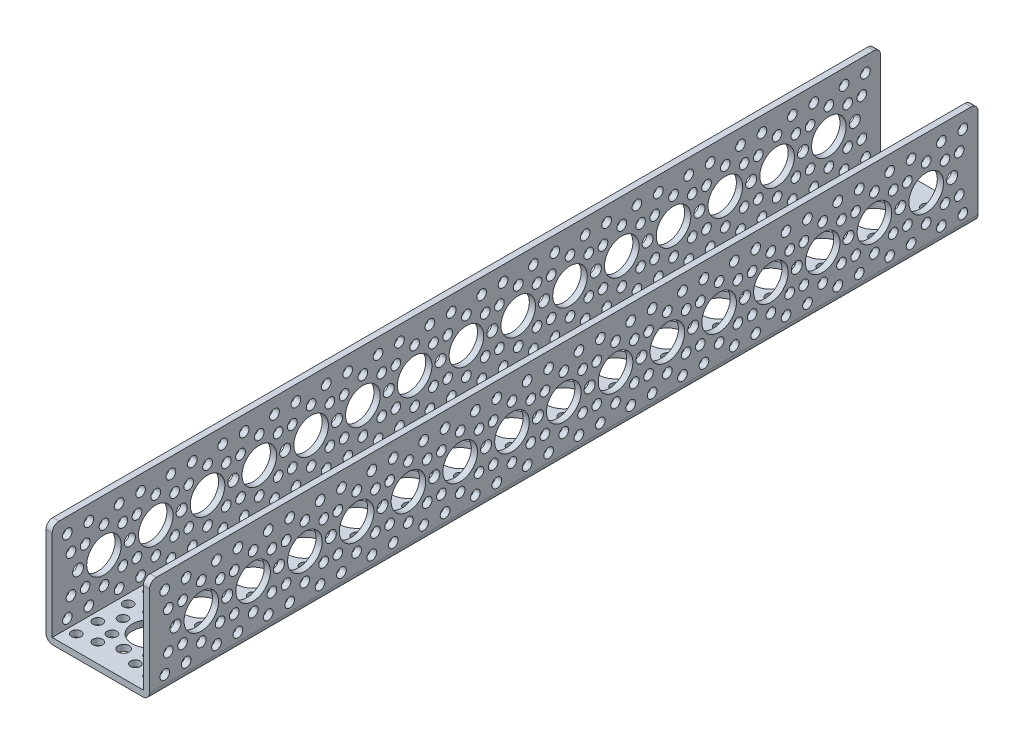
from build123d import *

# Parameters (mm, degrees)
SKETCH1_W                  = 38.1
SKETCH1_H                  = 304.8
BOSS_EXTRUDE1_DEPTH        = 38.1
SKETCH2_W                  = 33.528
SKETCH2_H                  = 35.814
CUT_EXTRUDE1_DEPTH         = 310.525863217
HOLE1_D                    = 12.7254
HOLE1_DEPTH                = 2.286
M3_CLEARANCE_HOLE1_D       = 3.556
M3_CLEARANCE_HOLE1_DEPTH   = 2.286
M3_5_CLEARANCE_HOLE1_D     = 4.064
M3_5_CLEARANCE_HOLE1_DEPTH = 2.286
HOLE2_D                    = 12.7254
HOLE2_DEPTH                = 38.1
M3_5_CLEARANCE_HOLE2_D     = 4.064
M3_5_CLEARANCE_HOLE2_DEPTH = 38.1
M3_CLEARANCE_HOLE2_D       = 3.556
M3_CLEARANCE_HOLE2_DEPTH   = 38.1
HOLE3_D                    = 12.7254
HOLE3_DEPTH                = 38.1
M3_CLEARANCE_HOLE3_D       = 3.556
M3_CLEARANCE_HOLE3_DEPTH   = 38.1
M3_5_CLEARANCE_HOLE3_D     = 4.064
M3_5_CLEARANCE_HOLE3_DEPTH = 38.1
FILLET1_R                  = 2.54


with BuildPart() as part:
    # Sketch1 → Boss-Extrude1 (new body)
    with BuildSketch(Plane.XZ):
        with Locations((19.05, 152.4)):
            Rectangle(SKETCH1_W, SKETCH1_H)
    extrude(amount=-BOSS_EXTRUDE1_DEPTH)

    # Sketch2 → Cut-Extrude1 (cut, through all)
    with BuildSketch(Plane.XY.offset(304.8)):
        with Locations((19.05, 20.193)):
            Rectangle(SKETCH2_W, SKETCH2_H)
    extrude(amount=-CUT_EXTRUDE1_DEPTH, mode=Mode.SUBTRACT)

    # Hole1
    with Locations(Plane(origin=(38.1, 0, 0), x_dir=(0, 0, -1), z_dir=(1, 0, 0))):
        with Locations((-38.1, 19.05), (-19.05, 19.05), (-57.15, 19.05), (-76.2, 19.05), (-95.25, 19.05), (-114.3, 19.05), (-133.35, 19.05), (-152.4, 19.05), (-171.45, 19.05), (-190.5, 19.05), (-209.55, 19.05), (-228.6, 19.05), (-247.65, 19.05), (-266.7, 19.05), (-285.75, 19.05)):
            Hole(HOLE1_D / 2, depth=HOLE1_DEPTH)

    # M3 Clearance Hole1
    with Locations(Plane(origin=(38.1, 0, 0), x_dir=(0, 0, -1), z_dir=(1, 0, 0))):
        with Locations((-291.329615818, 5.579615818), (-297.885202787, 12.135202787), (-291.329615818, 32.520384182), (-297.885202787, 25.964797213), (-13.470384182, 5.579615818), (-6.914797213, 12.135202787), (-13.470384182, 32.520384182), (-6.914797213, 25.964797213), (-272.279615818, 5.579615818), (-253.229615818, 5.579615818), (-234.179615818, 5.579615818), (-215.129615818, 5.579615818), (-196.079615818, 5.579615818), (-177.029615818, 5.579615818), (-157.979615818, 5.579615818), (-138.929615818, 5.579615818), (-119.879615818, 5.579615818), (-100.829615818, 5.579615818), (-81.779615818, 5.579615818), (-62.729615818, 5.579615818), (-43.679615818, 5.579615818), (-24.629615818, 5.579615818), (-272.279615818, 32.520384182), (-253.229615818, 32.520384182), (-234.179615818, 32.520384182), (-215.129615818, 32.520384182), (-196.079615818, 32.520384182), (-177.029615818, 32.520384182), (-157.979615818, 32.520384182), (-138.929615818, 32.520384182), (-119.879615818, 32.520384182), (-100.829615818, 32.520384182), (-81.779615818, 32.520384182), (-62.729615818, 32.520384182), (-43.679615818, 32.520384182), (-24.629615818, 32.520384182), (-299.220384182, 5.579615818), (-299.220384182, 32.520384182), (-280.170384182, 5.579615818), (-280.170384182, 32.520384182), (-261.120384182, 5.579615818), (-261.120384182, 32.520384182), (-242.070384182, 5.579615818), (-242.070384182, 32.520384182), (-223.020384182, 5.579615818), (-223.020384182, 32.520384182), (-203.970384182, 5.579615818), (-203.970384182, 32.520384182), (-184.920384182, 5.579615818), (-184.920384182, 32.520384182), (-165.870384182, 5.579615818), (-165.870384182, 32.520384182), (-146.820384182, 5.579615818), (-146.820384182, 32.520384182), (-127.770384182, 5.579615818), (-127.770384182, 32.520384182), (-108.720384182, 5.579615818), (-108.720384182, 32.520384182), (-89.670384182, 5.579615818), (-89.670384182, 32.520384182), (-70.620384182, 5.579615818), (-70.620384182, 32.520384182), (-51.570384182, 5.579615818), (-51.570384182, 32.520384182), (-38.1, 9.271), (-45.014797213, 12.135202787), (-45.014797213, 25.964797213), (-38.1, 28.829), (-31.185202787, 25.964797213), (-31.185202787, 12.135202787), (-32.520384182, 5.579615818), (-32.520384182, 32.520384182), (-5.579615818, 5.579615818), (-5.579615818, 32.520384182), (-12.135202787, 12.135202787), (-19.05, 9.271), (-25.964797213, 12.135202787), (-25.964797213, 25.964797213), (-19.05, 28.829), (-12.135202787, 25.964797213), (-50.235202787, 12.135202787), (-69.285202787, 12.135202787), (-88.335202787, 12.135202787), (-107.385202787, 12.135202787), (-126.435202787, 12.135202787), (-145.485202787, 12.135202787), (-164.535202787, 12.135202787), (-183.585202787, 12.135202787), (-202.635202787, 12.135202787), (-221.685202787, 12.135202787), (-240.735202787, 12.135202787), (-259.785202787, 12.135202787), (-278.835202787, 12.135202787), (-50.235202787, 25.964797213), (-69.285202787, 25.964797213), (-88.335202787, 25.964797213), (-107.385202787, 25.964797213), (-126.435202787, 25.964797213), (-145.485202787, 25.964797213), (-164.535202787, 25.964797213), (-183.585202787, 25.964797213), (-202.635202787, 25.964797213), (-221.685202787, 25.964797213), (-240.735202787, 25.964797213), (-259.785202787, 25.964797213), (-278.835202787, 25.964797213), (-57.15, 28.829), (-76.2, 28.829), (-95.25, 28.829), (-114.3, 28.829), (-133.35, 28.829), (-152.4, 28.829), (-171.45, 28.829), (-190.5, 28.829), (-209.55, 28.829), (-228.6, 28.829), (-247.65, 28.829), (-266.7, 28.829), (-285.75, 28.829), (-64.064797213, 25.964797213), (-83.114797213, 25.964797213), (-102.164797213, 25.964797213), (-121.214797213, 25.964797213), (-140.264797213, 25.964797213), (-159.314797213, 25.964797213), (-178.364797213, 25.964797213), (-197.414797213, 25.964797213), (-216.464797213, 25.964797213), (-235.514797213, 25.964797213), (-254.564797213, 25.964797213), (-273.614797213, 25.964797213), (-292.664797213, 25.964797213), (-64.064797213, 12.135202787), (-83.114797213, 12.135202787), (-102.164797213, 12.135202787), (-121.214797213, 12.135202787), (-140.264797213, 12.135202787), (-159.314797213, 12.135202787), (-178.364797213, 12.135202787), (-197.414797213, 12.135202787), (-216.464797213, 12.135202787), (-235.514797213, 12.135202787), (-254.564797213, 12.135202787), (-273.614797213, 12.135202787), (-292.664797213, 12.135202787), (-57.15, 9.271), (-76.2, 9.271), (-95.25, 9.271), (-114.3, 9.271), (-133.35, 9.271), (-152.4, 9.271), (-171.45, 9.271), (-190.5, 9.271), (-209.55, 9.271), (-228.6, 9.271), (-247.65, 9.271), (-266.7, 9.271), (-285.75, 9.271)):
            Hole(M3_CLEARANCE_HOLE1_D / 2, depth=M3_CLEARANCE_HOLE1_DEPTH)

    # M3.5 Clearance Hole1
    with Locations(Plane(origin=(38.1, 0, 0), x_dir=(0, 0, -1), z_dir=(1, 0, 0))):
        with Locations((-295.275, 19.05), (-276.225, 19.05), (-257.175, 19.05), (-238.125, 19.05), (-219.075, 19.05), (-200.025, 19.05), (-180.975, 19.05), (-161.925, 19.05), (-142.875, 19.05), (-123.825, 19.05), (-104.775, 19.05), (-85.725, 19.05), (-66.675, 19.05), (-47.625, 19.05), (-28.575, 19.05), (-9.525, 19.05)):
            Hole(M3_5_CLEARANCE_HOLE1_D / 2, depth=M3_5_CLEARANCE_HOLE1_DEPTH)

    # Hole2
    with Locations(Plane(origin=(0, 0, 0), x_dir=(-1, 0, 0), z_dir=(0, -1, 0))):
        with Locations((-19.05, -285.75), (-19.05, -266.7), (-19.05, -247.65), (-19.05, -228.6), (-19.05, -209.55), (-19.05, -190.5), (-19.05, -171.45), (-19.05, -152.4), (-19.05, -133.35), (-19.05, -114.3), (-19.05, -95.25), (-19.05, -76.2), (-19.05, -57.15), (-19.05, -38.1), (-19.05, -19.05)):
            Hole(HOLE2_D / 2, depth=HOLE2_DEPTH)

    # M3.5 Clearance Hole2
    with Locations(Plane(origin=(0, 0, 0), x_dir=(-1, 0, 0), z_dir=(0, -1, 0))):
        with Locations((-19.05, -295.275), (-19.05, -276.225), (-19.05, -257.175), (-19.05, -238.125), (-19.05, -219.075), (-19.05, -200.025), (-19.05, -180.975), (-19.05, -161.925), (-19.05, -142.875), (-19.05, -123.825), (-19.05, -104.775), (-19.05, -85.725), (-19.05, -66.675), (-19.05, -47.625), (-19.05, -28.575), (-19.05, -9.525)):
            Hole(M3_5_CLEARANCE_HOLE2_D / 2, depth=M3_5_CLEARANCE_HOLE2_DEPTH)

    # M3 Clearance Hole2
    with Locations(Plane(origin=(0, 0, 0), x_dir=(-1, 0, 0), z_dir=(0, -1, 0))):
        with Locations((-5.579615818, -299.220384182), (-5.579615818, -291.329615818), (-12.135202787, -297.885202787), (-32.520384182, -299.220384182), (-32.520384182, -291.329615818), (-25.964797213, -297.885202787), (-5.579615818, -280.170384182), (-5.579615818, -272.279615818), (-32.520384182, -280.170384182), (-32.520384182, -272.279615818), (-5.579615818, -261.120384182), (-5.579615818, -253.229615818), (-32.520384182, -261.120384182), (-32.520384182, -253.229615818), (-5.579615818, -242.070384182), (-5.579615818, -234.179615818), (-32.520384182, -242.070384182), (-32.520384182, -234.179615818), (-5.579615818, -223.020384182), (-5.579615818, -215.129615818), (-32.520384182, -223.020384182), (-32.520384182, -215.129615818), (-5.579615818, -203.970384182), (-5.579615818, -196.079615818), (-32.520384182, -203.970384182), (-32.520384182, -196.079615818), (-5.579615818, -184.920384182), (-5.579615818, -177.029615818), (-32.520384182, -184.920384182), (-32.520384182, -177.029615818), (-5.579615818, -165.870384182), (-5.579615818, -157.979615818), (-32.520384182, -165.870384182), (-32.520384182, -157.979615818), (-5.579615818, -146.820384182), (-5.579615818, -138.929615818), (-32.520384182, -146.820384182), (-32.520384182, -138.929615818), (-5.579615818, -127.770384182), (-5.579615818, -119.879615818), (-32.520384182, -127.770384182), (-32.520384182, -119.879615818), (-5.579615818, -108.720384182), (-5.579615818, -100.829615818), (-32.520384182, -108.720384182), (-32.520384182, -100.829615818), (-5.579615818, -89.670384182), (-5.579615818, -81.779615818), (-32.520384182, -89.670384182), (-32.520384182, -81.779615818), (-5.579615818, -70.620384182), (-5.579615818, -62.729615818), (-32.520384182, -70.620384182), (-32.520384182, -62.729615818), (-5.579615818, -51.570384182), (-5.579615818, -43.679615818), (-32.520384182, -51.570384182), (-32.520384182, -43.679615818), (-12.135202787, -278.835202787), (-9.271, -285.75), (-12.135202787, -292.664797213), (-25.964797213, -292.664797213), (-28.829, -285.75), (-25.964797213, -278.835202787), (-12.135202787, -259.785202787), (-9.271, -266.7), (-12.135202787, -273.614797213), (-25.964797213, -273.614797213), (-28.829, -266.7), (-25.964797213, -259.785202787), (-12.135202787, -240.735202787), (-9.271, -247.65), (-12.135202787, -254.564797213), (-25.964797213, -254.564797213), (-28.829, -247.65), (-25.964797213, -240.735202787), (-12.135202787, -221.685202787), (-9.271, -228.6), (-12.135202787, -235.514797213), (-25.964797213, -235.514797213), (-28.829, -228.6), (-25.964797213, -221.685202787), (-12.135202787, -202.635202787), (-9.271, -209.55), (-12.135202787, -216.464797213), (-25.964797213, -216.464797213), (-28.829, -209.55), (-25.964797213, -202.635202787), (-12.135202787, -183.585202787), (-9.271, -190.5), (-12.135202787, -197.414797213), (-25.964797213, -197.414797213), (-28.829, -190.5), (-25.964797213, -183.585202787), (-12.135202787, -164.535202787), (-9.271, -171.45), (-12.135202787, -178.364797213), (-25.964797213, -178.364797213), (-28.829, -171.45), (-25.964797213, -164.535202787), (-12.135202787, -145.485202787), (-9.271, -152.4), (-12.135202787, -159.314797213), (-25.964797213, -159.314797213), (-28.829, -152.4), (-25.964797213, -145.485202787), (-12.135202787, -126.435202787), (-9.271, -133.35), (-12.135202787, -140.264797213), (-25.964797213, -140.264797213), (-28.829, -133.35), (-25.964797213, -126.435202787), (-12.135202787, -107.385202787), (-9.271, -114.3), (-12.135202787, -121.214797213), (-25.964797213, -121.214797213), (-28.829, -114.3), (-25.964797213, -107.385202787), (-12.135202787, -88.335202787), (-9.271, -95.25), (-12.135202787, -102.164797213), (-25.964797213, -102.164797213), (-28.829, -95.25), (-25.964797213, -88.335202787), (-12.135202787, -69.285202787), (-9.271, -76.2), (-12.135202787, -83.114797213), (-25.964797213, -83.114797213), (-28.829, -76.2), (-25.964797213, -69.285202787), (-12.135202787, -50.235202787), (-9.271, -57.15), (-12.135202787, -64.064797213), (-25.964797213, -64.064797213), (-28.829, -57.15), (-25.964797213, -50.235202787), (-9.271, -38.1), (-12.135202787, -45.014797213), (-25.964797213, -45.014797213), (-28.829, -38.1), (-5.579615818, -32.520384182), (-5.579615818, -24.629615818), (-12.135202787, -31.185202787), (-32.520384182, -32.520384182), (-32.520384182, -24.629615818), (-25.964797213, -31.185202787), (-5.579615818, -5.579615818), (-5.579615818, -13.470384182), (-12.135202787, -6.914797213), (-32.520384182, -5.579615818), (-32.520384182, -13.470384182), (-25.964797213, -6.914797213), (-12.135202787, -12.135202787), (-9.271, -19.05), (-12.135202787, -25.964797213), (-25.964797213, -25.964797213), (-28.829, -19.05), (-25.964797213, -12.135202787)):
            Hole(M3_CLEARANCE_HOLE2_D / 2, depth=M3_CLEARANCE_HOLE2_DEPTH)

    # Hole3
    with Locations(Plane.ZY):
        with Locations((38.1, 19.05), (19.05, 19.05), (57.15, 19.05), (76.2, 19.05), (95.25, 19.05), (114.3, 19.05), (133.35, 19.05), (152.4, 19.05), (171.45, 19.05), (190.5, 19.05), (209.55, 19.05), (228.6, 19.05), (247.65, 19.05), (266.7, 19.05), (285.75, 19.05)):
            Hole(HOLE3_D / 2, depth=HOLE3_DEPTH)

    # M3 Clearance Hole3
    with Locations(Plane.ZY):
        with Locations((291.329615818, 5.579615818), (297.885202787, 12.135202787), (291.329615818, 32.520384182), (297.885202787, 25.964797213), (13.470384182, 5.579615818), (6.914797213, 12.135202787), (13.470384182, 32.520384182), (6.914797213, 25.964797213), (272.279615818, 5.579615818), (253.229615818, 5.579615818), (234.179615818, 5.579615818), (215.129615818, 5.579615818), (196.079615818, 5.579615818), (177.029615818, 5.579615818), (157.979615818, 5.579615818), (138.929615818, 5.579615818), (119.879615818, 5.579615818), (100.829615818, 5.579615818), (81.779615818, 5.579615818), (62.729615818, 5.579615818), (43.679615818, 5.579615818), (24.629615818, 5.579615818), (272.279615818, 32.520384182), (253.229615818, 32.520384182), (234.179615818, 32.520384182), (215.129615818, 32.520384182), (196.079615818, 32.520384182), (177.029615818, 32.520384182), (157.979615818, 32.520384182), (138.929615818, 32.520384182), (119.879615818, 32.520384182), (100.829615818, 32.520384182), (81.779615818, 32.520384182), (62.729615818, 32.520384182), (43.679615818, 32.520384182), (24.629615818, 32.520384182), (299.220384182, 5.579615818), (299.220384182, 32.520384182), (280.170384182, 5.579615818), (280.170384182, 32.520384182), (261.120384182, 5.579615818), (261.120384182, 32.520384182), (242.070384182, 5.579615818), (242.070384182, 32.520384182), (223.020384182, 5.579615818), (223.020384182, 32.520384182), (203.970384182, 5.579615818), (203.970384182, 32.520384182), (184.920384182, 5.579615818), (184.920384182, 32.520384182), (165.870384182, 5.579615818), (165.870384182, 32.520384182), (146.820384182, 5.579615818), (146.820384182, 32.520384182), (127.770384182, 5.579615818), (127.770384182, 32.520384182), (108.720384182, 5.579615818), (108.720384182, 32.520384182), (89.670384182, 5.579615818), (89.670384182, 32.520384182), (70.620384182, 5.579615818), (70.620384182, 32.520384182), (51.570384182, 5.579615818), (51.570384182, 32.520384182), (31.185202787, 12.135202787), (38.1, 9.271), (45.014797213, 12.135202787), (45.014797213, 25.964797213), (38.1, 28.829), (31.185202787, 25.964797213), (32.520384182, 5.579615818), (32.520384182, 32.520384182), (5.579615818, 5.579615818), (5.579615818, 32.520384182), (12.135202787, 12.135202787), (19.05, 9.271), (25.964797213, 12.135202787), (25.964797213, 25.964797213), (19.05, 28.829), (12.135202787, 25.964797213), (50.235202787, 25.964797213), (69.285202787, 25.964797213), (88.335202787, 25.964797213), (107.385202787, 25.964797213), (126.435202787, 25.964797213), (145.485202787, 25.964797213), (164.535202787, 25.964797213), (183.585202787, 25.964797213), (202.635202787, 25.964797213), (221.685202787, 25.964797213), (240.735202787, 25.964797213), (259.785202787, 25.964797213), (278.835202787, 25.964797213), (57.15, 28.829), (76.2, 28.829), (95.25, 28.829), (114.3, 28.829), (133.35, 28.829), (152.4, 28.829), (171.45, 28.829), (190.5, 28.829), (209.55, 28.829), (228.6, 28.829), (247.65, 28.829), (266.7, 28.829), (285.75, 28.829), (64.064797213, 25.964797213), (83.114797213, 25.964797213), (102.164797213, 25.964797213), (121.214797213, 25.964797213), (140.264797213, 25.964797213), (159.314797213, 25.964797213), (178.364797213, 25.964797213), (197.414797213, 25.964797213), (216.464797213, 25.964797213), (235.514797213, 25.964797213), (254.564797213, 25.964797213), (273.614797213, 25.964797213), (292.664797213, 25.964797213), (64.064797213, 12.135202787), (83.114797213, 12.135202787), (102.164797213, 12.135202787), (121.214797213, 12.135202787), (140.264797213, 12.135202787), (159.314797213, 12.135202787), (178.364797213, 12.135202787), (197.414797213, 12.135202787), (216.464797213, 12.135202787), (235.514797213, 12.135202787), (254.564797213, 12.135202787), (273.614797213, 12.135202787), (292.664797213, 12.135202787), (57.15, 9.271), (76.2, 9.271), (95.25, 9.271), (114.3, 9.271), (133.35, 9.271), (152.4, 9.271), (171.45, 9.271), (190.5, 9.271), (209.55, 9.271), (228.6, 9.271), (247.65, 9.271), (266.7, 9.271), (285.75, 9.271), (50.235202787, 12.135202787), (69.285202787, 12.135202787), (88.335202787, 12.135202787), (107.385202787, 12.135202787), (126.435202787, 12.135202787), (145.485202787, 12.135202787), (164.535202787, 12.135202787), (183.585202787, 12.135202787), (202.635202787, 12.135202787), (221.685202787, 12.135202787), (240.735202787, 12.135202787), (259.785202787, 12.135202787), (278.835202787, 12.135202787)):
            Hole(M3_CLEARANCE_HOLE3_D / 2, depth=M3_CLEARANCE_HOLE3_DEPTH)

    # M3.5 Clearance Hole3
    with Locations(Plane.ZY):
        with Locations((295.275, 19.05), (276.225, 19.05), (257.175, 19.05), (238.125, 19.05), (219.075, 19.05), (200.025, 19.05), (180.975, 19.05), (161.925, 19.05), (142.875, 19.05), (123.825, 19.05), (104.775, 19.05), (85.725, 19.05), (66.675, 19.05), (47.625, 19.05), (28.575, 19.05), (9.525, 19.05)):
            Hole(M3_5_CLEARANCE_HOLE3_D / 2, depth=M3_5_CLEARANCE_HOLE3_DEPTH)

    # Fillet1
    fillet1_edges = [part.edges().sort_by_distance(p)[0] for p in [
        (1.143, 38.1, 304.8),
        (36.957, 38.1, 304.8),
        (36.957, 38.1, 0),
        (38.1, 0, 152.4),
        (1.143, 38.1, 0),
        (0, 0, 152.4),
    ]]
    fillet(fillet1_edges, radius=FILLET1_R)


solid = part.part
